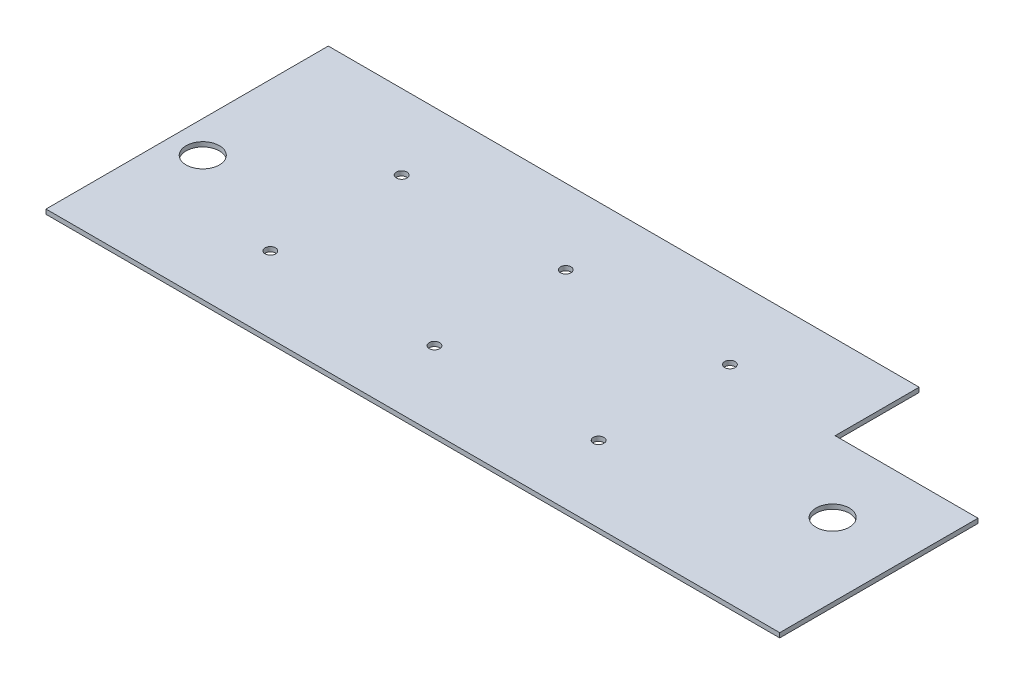
from build123d import *

# Parameters (mm, degrees)
BOSS_EXTRUDE1_DEPTH     = 3.5
CUT_EXTRUDE1_DEPTH      = 599.744260933
CUT_EXTRUDE1_DEPTH_BACK = 599.744260933
SKETCH2_R               = 4
SKETCH3_R               = 12.7
CUT_EXTRUDE2_DEPTH      = 10


with BuildPart() as part:
    # Sketch1 → Boss-Extrude1 (new body)
    with BuildSketch(Plane(origin=(0, 0, 0), x_dir=(1, 0, 0), z_dir=(0, 1, 0))):
        Polygon((0, 0), (0, 215), (450, 215), (450, 151), (558.8, 151), (558.8, 0), align=None)
    extrude(amount=BOSS_EXTRUDE1_DEPTH)

    # Sketch2 → Cut-Extrude1 (cut, two sides: drawn at the far end of the back side and taken through both)
    with BuildSketch(Plane(origin=(0, 3.5, 0), x_dir=(1, 0, 0), z_dir=(0, 1, 0)).offset(-CUT_EXTRUDE1_DEPTH_BACK)):
        with Locations((113, 157.85)):
            Circle(SKETCH2_R)
        with Locations((238, 157.85)):
            Circle(SKETCH2_R)
        with Locations((363, 157.85)):
            Circle(SKETCH2_R)
        with Locations((363, 57.85)):
            Circle(SKETCH2_R)
        with Locations((238, 57.85)):
            Circle(SKETCH2_R)
        with Locations((113, 57.85)):
            Circle(SKETCH2_R)
    extrude(amount=CUT_EXTRUDE1_DEPTH + CUT_EXTRUDE1_DEPTH_BACK, mode=Mode.SUBTRACT)

    # Sketch3 → Cut-Extrude2 (cut)
    with BuildSketch(Plane(origin=(0, 3.5, 0), x_dir=(1, 0, 0), z_dir=(0, 1, 0))):
        with Locations((503.07316, 96.03863)):
            Circle(SKETCH3_R)
        with Locations((24.24663, 95.1435)):
            Circle(SKETCH3_R)
    extrude(amount=-CUT_EXTRUDE2_DEPTH, mode=Mode.SUBTRACT)


solid = part.part
